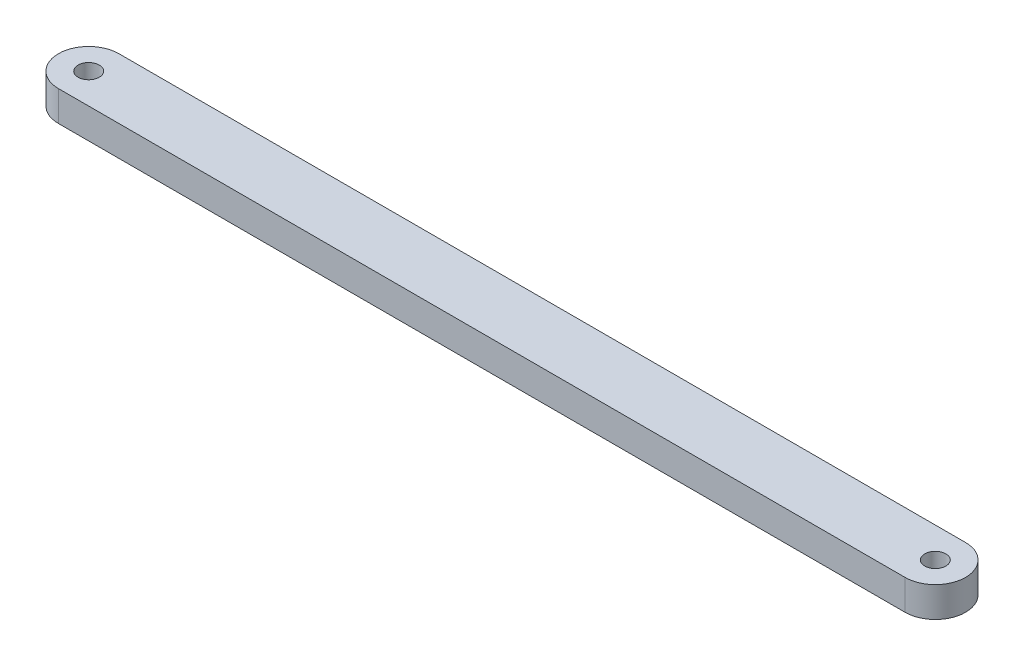
from build123d import *

# Parameters (mm, degrees)
SKETCH1_R           = 3.5
BOSS_EXTRUDE1_DEPTH = 10


with BuildPart() as part:
    # Sketch1 → Boss-Extrude1 (new body)
    with BuildSketch(Plane(origin=(0, 0, 0), x_dir=(1, 0, 0), z_dir=(0, 1, 0))):
        with BuildLine():
            Line((-140, 10), (140, 10))
            ThreePointArc((140, 10), (150, 0), (140, -10))
            Line((140, -10), (-140, -10))
            ThreePointArc((-140, -10), (-150, 0), (-140, 10))
        make_face()
        with Locations((-140, 0)):
            Circle(SKETCH1_R, mode=Mode.SUBTRACT)
        with Locations((140, 0)):
            Circle(SKETCH1_R, mode=Mode.SUBTRACT)
    extrude(amount=BOSS_EXTRUDE1_DEPTH)


solid = part.part
